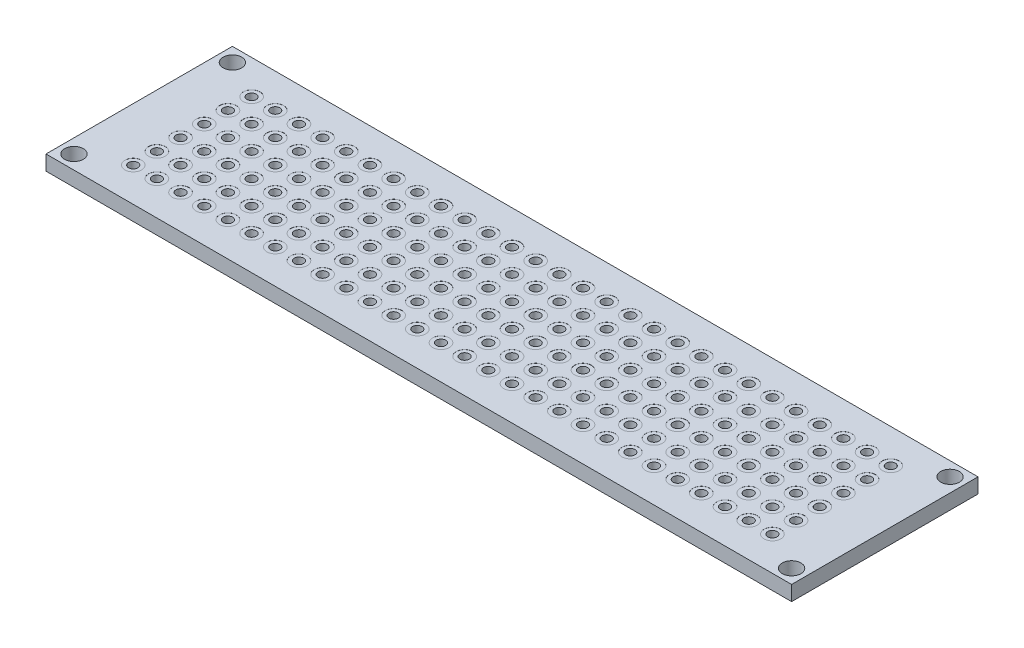
from build123d import *

# Parameters (mm, degrees)
SKETCH1_W           = 80
SKETCH1_H           = 20
SKETCH1_R           = 0.5
SKETCH1_R_2         = 1
BOSS_EXTRUDE1_DEPTH = 1.6
SKETCH2_R           = 0.9
CUT_EXTRUDE1_DEPTH  = 0.01
CUT_EXTRUDE2_START  = -0.01
SKETCH3_R           = 0.9
CUT_EXTRUDE2_DEPTH  = 0.01


with BuildPart() as part:
    # Sketch1 → Boss-Extrude1 (new body)
    with BuildSketch(Plane(origin=(0, 0, 0), x_dir=(1, 0, 0), z_dir=(0, 1, 0))):
        with Locations((40, 10)):
            Rectangle(SKETCH1_W, SKETCH1_H)
        with Locations((5.71, 16.35)):
            Circle(SKETCH1_R, mode=Mode.SUBTRACT)
        with Locations((5.71, 13.81)):
            Circle(SKETCH1_R, mode=Mode.SUBTRACT)
        with Locations((5.71, 11.27)):
            Circle(SKETCH1_R, mode=Mode.SUBTRACT)
        with Locations((5.71, 8.73)):
            Circle(SKETCH1_R, mode=Mode.SUBTRACT)
        with Locations((5.71, 6.19)):
            Circle(SKETCH1_R, mode=Mode.SUBTRACT)
        with Locations((5.71, 3.65)):
            Circle(SKETCH1_R, mode=Mode.SUBTRACT)
        with Locations((8.25, 16.35)):
            Circle(SKETCH1_R, mode=Mode.SUBTRACT)
        with Locations((8.25, 13.81)):
            Circle(SKETCH1_R, mode=Mode.SUBTRACT)
        with Locations((8.25, 11.27)):
            Circle(SKETCH1_R, mode=Mode.SUBTRACT)
        with Locations((8.25, 8.73)):
            Circle(SKETCH1_R, mode=Mode.SUBTRACT)
        with Locations((8.25, 6.19)):
            Circle(SKETCH1_R, mode=Mode.SUBTRACT)
        with Locations((8.25, 3.65)):
            Circle(SKETCH1_R, mode=Mode.SUBTRACT)
        with Locations((10.79, 16.35)):
            Circle(SKETCH1_R, mode=Mode.SUBTRACT)
        with Locations((10.79, 13.81)):
            Circle(SKETCH1_R, mode=Mode.SUBTRACT)
        with Locations((10.79, 11.27)):
            Circle(SKETCH1_R, mode=Mode.SUBTRACT)
        with Locations((10.79, 8.73)):
            Circle(SKETCH1_R, mode=Mode.SUBTRACT)
        with Locations((10.79, 6.19)):
            Circle(SKETCH1_R, mode=Mode.SUBTRACT)
        with Locations((10.79, 3.65)):
            Circle(SKETCH1_R, mode=Mode.SUBTRACT)
        with Locations((13.33, 16.35)):
            Circle(SKETCH1_R, mode=Mode.SUBTRACT)
        with Locations((13.33, 13.81)):
            Circle(SKETCH1_R, mode=Mode.SUBTRACT)
        with Locations((13.33, 11.27)):
            Circle(SKETCH1_R, mode=Mode.SUBTRACT)
        with Locations((13.33, 8.73)):
            Circle(SKETCH1_R, mode=Mode.SUBTRACT)
        with Locations((13.33, 6.19)):
            Circle(SKETCH1_R, mode=Mode.SUBTRACT)
        with Locations((13.33, 3.65)):
            Circle(SKETCH1_R, mode=Mode.SUBTRACT)
        with Locations((15.87, 16.35)):
            Circle(SKETCH1_R, mode=Mode.SUBTRACT)
        with Locations((15.87, 13.81)):
            Circle(SKETCH1_R, mode=Mode.SUBTRACT)
        with Locations((15.87, 11.27)):
            Circle(SKETCH1_R, mode=Mode.SUBTRACT)
        with Locations((15.87, 8.73)):
            Circle(SKETCH1_R, mode=Mode.SUBTRACT)
        with Locations((15.87, 6.19)):
            Circle(SKETCH1_R, mode=Mode.SUBTRACT)
        with Locations((15.87, 3.65)):
            Circle(SKETCH1_R, mode=Mode.SUBTRACT)
        with Locations((18.41, 16.35)):
            Circle(SKETCH1_R, mode=Mode.SUBTRACT)
        with Locations((18.41, 13.81)):
            Circle(SKETCH1_R, mode=Mode.SUBTRACT)
        with Locations((18.41, 11.27)):
            Circle(SKETCH1_R, mode=Mode.SUBTRACT)
        with Locations((18.41, 8.73)):
            Circle(SKETCH1_R, mode=Mode.SUBTRACT)
        with Locations((18.41, 6.19)):
            Circle(SKETCH1_R, mode=Mode.SUBTRACT)
        with Locations((18.41, 3.65)):
            Circle(SKETCH1_R, mode=Mode.SUBTRACT)
        with Locations((20.95, 16.35)):
            Circle(SKETCH1_R, mode=Mode.SUBTRACT)
        with Locations((20.95, 13.81)):
            Circle(SKETCH1_R, mode=Mode.SUBTRACT)
        with Locations((20.95, 11.27)):
            Circle(SKETCH1_R, mode=Mode.SUBTRACT)
        with Locations((20.95, 8.73)):
            Circle(SKETCH1_R, mode=Mode.SUBTRACT)
        with Locations((20.95, 6.19)):
            Circle(SKETCH1_R, mode=Mode.SUBTRACT)
        with Locations((20.95, 3.65)):
            Circle(SKETCH1_R, mode=Mode.SUBTRACT)
        with Locations((23.49, 16.35)):
            Circle(SKETCH1_R, mode=Mode.SUBTRACT)
        with Locations((23.49, 13.81)):
            Circle(SKETCH1_R, mode=Mode.SUBTRACT)
        with Locations((23.49, 11.27)):
            Circle(SKETCH1_R, mode=Mode.SUBTRACT)
        with Locations((23.49, 8.73)):
            Circle(SKETCH1_R, mode=Mode.SUBTRACT)
        with Locations((23.49, 6.19)):
            Circle(SKETCH1_R, mode=Mode.SUBTRACT)
        with Locations((23.49, 3.65)):
            Circle(SKETCH1_R, mode=Mode.SUBTRACT)
        with Locations((26.03, 16.35)):
            Circle(SKETCH1_R, mode=Mode.SUBTRACT)
        with Locations((26.03, 13.81)):
            Circle(SKETCH1_R, mode=Mode.SUBTRACT)
        with Locations((26.03, 11.27)):
            Circle(SKETCH1_R, mode=Mode.SUBTRACT)
        with Locations((26.03, 8.73)):
            Circle(SKETCH1_R, mode=Mode.SUBTRACT)
        with Locations((26.03, 6.19)):
            Circle(SKETCH1_R, mode=Mode.SUBTRACT)
        with Locations((26.03, 3.65)):
            Circle(SKETCH1_R, mode=Mode.SUBTRACT)
        with Locations((28.57, 16.35)):
            Circle(SKETCH1_R, mode=Mode.SUBTRACT)
        with Locations((28.57, 13.81)):
            Circle(SKETCH1_R, mode=Mode.SUBTRACT)
        with Locations((28.57, 11.27)):
            Circle(SKETCH1_R, mode=Mode.SUBTRACT)
        with Locations((28.57, 8.73)):
            Circle(SKETCH1_R, mode=Mode.SUBTRACT)
        with Locations((28.57, 6.19)):
            Circle(SKETCH1_R, mode=Mode.SUBTRACT)
        with Locations((28.57, 3.65)):
            Circle(SKETCH1_R, mode=Mode.SUBTRACT)
        with Locations((31.11, 16.35)):
            Circle(SKETCH1_R, mode=Mode.SUBTRACT)
        with Locations((31.11, 13.81)):
            Circle(SKETCH1_R, mode=Mode.SUBTRACT)
        with Locations((31.11, 11.27)):
            Circle(SKETCH1_R, mode=Mode.SUBTRACT)
        with Locations((31.11, 8.73)):
            Circle(SKETCH1_R, mode=Mode.SUBTRACT)
        with Locations((31.11, 6.19)):
            Circle(SKETCH1_R, mode=Mode.SUBTRACT)
        with Locations((31.11, 3.65)):
            Circle(SKETCH1_R, mode=Mode.SUBTRACT)
        with Locations((33.65, 16.35)):
            Circle(SKETCH1_R, mode=Mode.SUBTRACT)
        with Locations((33.65, 13.81)):
            Circle(SKETCH1_R, mode=Mode.SUBTRACT)
        with Locations((33.65, 11.27)):
            Circle(SKETCH1_R, mode=Mode.SUBTRACT)
        with Locations((33.65, 8.73)):
            Circle(SKETCH1_R, mode=Mode.SUBTRACT)
        with Locations((33.65, 6.19)):
            Circle(SKETCH1_R, mode=Mode.SUBTRACT)
        with Locations((33.65, 3.65)):
            Circle(SKETCH1_R, mode=Mode.SUBTRACT)
        with Locations((36.19, 16.35)):
            Circle(SKETCH1_R, mode=Mode.SUBTRACT)
        with Locations((36.19, 13.81)):
            Circle(SKETCH1_R, mode=Mode.SUBTRACT)
        with Locations((36.19, 11.27)):
            Circle(SKETCH1_R, mode=Mode.SUBTRACT)
        with Locations((36.19, 8.73)):
            Circle(SKETCH1_R, mode=Mode.SUBTRACT)
        with Locations((36.19, 6.19)):
            Circle(SKETCH1_R, mode=Mode.SUBTRACT)
        with Locations((36.19, 3.65)):
            Circle(SKETCH1_R, mode=Mode.SUBTRACT)
        with Locations((38.73, 16.35)):
            Circle(SKETCH1_R, mode=Mode.SUBTRACT)
        with Locations((38.73, 13.81)):
            Circle(SKETCH1_R, mode=Mode.SUBTRACT)
        with Locations((38.73, 11.27)):
            Circle(SKETCH1_R, mode=Mode.SUBTRACT)
        with Locations((38.73, 8.73)):
            Circle(SKETCH1_R, mode=Mode.SUBTRACT)
        with Locations((38.73, 6.19)):
            Circle(SKETCH1_R, mode=Mode.SUBTRACT)
        with Locations((38.73, 3.65)):
            Circle(SKETCH1_R, mode=Mode.SUBTRACT)
        with Locations((41.27, 16.35)):
            Circle(SKETCH1_R, mode=Mode.SUBTRACT)
        with Locations((41.27, 13.81)):
            Circle(SKETCH1_R, mode=Mode.SUBTRACT)
        with Locations((41.27, 11.27)):
            Circle(SKETCH1_R, mode=Mode.SUBTRACT)
        with Locations((41.27, 8.73)):
            Circle(SKETCH1_R, mode=Mode.SUBTRACT)
        with Locations((41.27, 6.19)):
            Circle(SKETCH1_R, mode=Mode.SUBTRACT)
        with Locations((41.27, 3.65)):
            Circle(SKETCH1_R, mode=Mode.SUBTRACT)
        with Locations((43.81, 16.35)):
            Circle(SKETCH1_R, mode=Mode.SUBTRACT)
        with Locations((43.81, 13.81)):
            Circle(SKETCH1_R, mode=Mode.SUBTRACT)
        with Locations((43.81, 11.27)):
            Circle(SKETCH1_R, mode=Mode.SUBTRACT)
        with Locations((43.81, 8.73)):
            Circle(SKETCH1_R, mode=Mode.SUBTRACT)
        with Locations((43.81, 6.19)):
            Circle(SKETCH1_R, mode=Mode.SUBTRACT)
        with Locations((43.81, 3.65)):
            Circle(SKETCH1_R, mode=Mode.SUBTRACT)
        with Locations((46.35, 16.35)):
            Circle(SKETCH1_R, mode=Mode.SUBTRACT)
        with Locations((46.35, 13.81)):
            Circle(SKETCH1_R, mode=Mode.SUBTRACT)
        with Locations((46.35, 11.27)):
            Circle(SKETCH1_R, mode=Mode.SUBTRACT)
        with Locations((46.35, 8.73)):
            Circle(SKETCH1_R, mode=Mode.SUBTRACT)
        with Locations((46.35, 6.19)):
            Circle(SKETCH1_R, mode=Mode.SUBTRACT)
        with Locations((46.35, 3.65)):
            Circle(SKETCH1_R, mode=Mode.SUBTRACT)
        with Locations((48.89, 16.35)):
            Circle(SKETCH1_R, mode=Mode.SUBTRACT)
        with Locations((48.89, 13.81)):
            Circle(SKETCH1_R, mode=Mode.SUBTRACT)
        with Locations((48.89, 11.27)):
            Circle(SKETCH1_R, mode=Mode.SUBTRACT)
        with Locations((48.89, 8.73)):
            Circle(SKETCH1_R, mode=Mode.SUBTRACT)
        with Locations((48.89, 6.19)):
            Circle(SKETCH1_R, mode=Mode.SUBTRACT)
        with Locations((48.89, 3.65)):
            Circle(SKETCH1_R, mode=Mode.SUBTRACT)
        with Locations((51.43, 16.35)):
            Circle(SKETCH1_R, mode=Mode.SUBTRACT)
        with Locations((51.43, 13.81)):
            Circle(SKETCH1_R, mode=Mode.SUBTRACT)
        with Locations((51.43, 11.27)):
            Circle(SKETCH1_R, mode=Mode.SUBTRACT)
        with Locations((51.43, 8.73)):
            Circle(SKETCH1_R, mode=Mode.SUBTRACT)
        with Locations((51.43, 6.19)):
            Circle(SKETCH1_R, mode=Mode.SUBTRACT)
        with Locations((51.43, 3.65)):
            Circle(SKETCH1_R, mode=Mode.SUBTRACT)
        with Locations((53.97, 16.35)):
            Circle(SKETCH1_R, mode=Mode.SUBTRACT)
        with Locations((53.97, 13.81)):
            Circle(SKETCH1_R, mode=Mode.SUBTRACT)
        with Locations((53.97, 11.27)):
            Circle(SKETCH1_R, mode=Mode.SUBTRACT)
        with Locations((53.97, 8.73)):
            Circle(SKETCH1_R, mode=Mode.SUBTRACT)
        with Locations((53.97, 6.19)):
            Circle(SKETCH1_R, mode=Mode.SUBTRACT)
        with Locations((53.97, 3.65)):
            Circle(SKETCH1_R, mode=Mode.SUBTRACT)
        with Locations((56.51, 16.35)):
            Circle(SKETCH1_R, mode=Mode.SUBTRACT)
        with Locations((56.51, 13.81)):
            Circle(SKETCH1_R, mode=Mode.SUBTRACT)
        with Locations((56.51, 11.27)):
            Circle(SKETCH1_R, mode=Mode.SUBTRACT)
        with Locations((56.51, 8.73)):
            Circle(SKETCH1_R, mode=Mode.SUBTRACT)
        with Locations((56.51, 6.19)):
            Circle(SKETCH1_R, mode=Mode.SUBTRACT)
        with Locations((56.51, 3.65)):
            Circle(SKETCH1_R, mode=Mode.SUBTRACT)
        with Locations((59.05, 16.35)):
            Circle(SKETCH1_R, mode=Mode.SUBTRACT)
        with Locations((59.05, 13.81)):
            Circle(SKETCH1_R, mode=Mode.SUBTRACT)
        with Locations((59.05, 11.27)):
            Circle(SKETCH1_R, mode=Mode.SUBTRACT)
        with Locations((59.05, 8.73)):
            Circle(SKETCH1_R, mode=Mode.SUBTRACT)
        with Locations((59.05, 6.19)):
            Circle(SKETCH1_R, mode=Mode.SUBTRACT)
        with Locations((59.05, 3.65)):
            Circle(SKETCH1_R, mode=Mode.SUBTRACT)
        with Locations((61.59, 16.35)):
            Circle(SKETCH1_R, mode=Mode.SUBTRACT)
        with Locations((61.59, 13.81)):
            Circle(SKETCH1_R, mode=Mode.SUBTRACT)
        with Locations((61.59, 11.27)):
            Circle(SKETCH1_R, mode=Mode.SUBTRACT)
        with Locations((61.59, 8.73)):
            Circle(SKETCH1_R, mode=Mode.SUBTRACT)
        with Locations((61.59, 6.19)):
            Circle(SKETCH1_R, mode=Mode.SUBTRACT)
        with Locations((61.59, 3.65)):
            Circle(SKETCH1_R, mode=Mode.SUBTRACT)
        with Locations((64.13, 16.35)):
            Circle(SKETCH1_R, mode=Mode.SUBTRACT)
        with Locations((64.13, 13.81)):
            Circle(SKETCH1_R, mode=Mode.SUBTRACT)
        with Locations((64.13, 11.27)):
            Circle(SKETCH1_R, mode=Mode.SUBTRACT)
        with Locations((64.13, 8.73)):
            Circle(SKETCH1_R, mode=Mode.SUBTRACT)
        with Locations((64.13, 6.19)):
            Circle(SKETCH1_R, mode=Mode.SUBTRACT)
        with Locations((64.13, 3.65)):
            Circle(SKETCH1_R, mode=Mode.SUBTRACT)
        with Locations((66.67, 16.35)):
            Circle(SKETCH1_R, mode=Mode.SUBTRACT)
        with Locations((66.67, 13.81)):
            Circle(SKETCH1_R, mode=Mode.SUBTRACT)
        with Locations((66.67, 11.27)):
            Circle(SKETCH1_R, mode=Mode.SUBTRACT)
        with Locations((66.67, 8.73)):
            Circle(SKETCH1_R, mode=Mode.SUBTRACT)
        with Locations((66.67, 6.19)):
            Circle(SKETCH1_R, mode=Mode.SUBTRACT)
        with Locations((66.67, 3.65)):
            Circle(SKETCH1_R, mode=Mode.SUBTRACT)
        with Locations((69.21, 16.35)):
            Circle(SKETCH1_R, mode=Mode.SUBTRACT)
        with Locations((69.21, 13.81)):
            Circle(SKETCH1_R, mode=Mode.SUBTRACT)
        with Locations((69.21, 11.27)):
            Circle(SKETCH1_R, mode=Mode.SUBTRACT)
        with Locations((69.21, 8.73)):
            Circle(SKETCH1_R, mode=Mode.SUBTRACT)
        with Locations((69.21, 6.19)):
            Circle(SKETCH1_R, mode=Mode.SUBTRACT)
        with Locations((69.21, 3.65)):
            Circle(SKETCH1_R, mode=Mode.SUBTRACT)
        with Locations((71.75, 16.35)):
            Circle(SKETCH1_R, mode=Mode.SUBTRACT)
        with Locations((71.75, 13.81)):
            Circle(SKETCH1_R, mode=Mode.SUBTRACT)
        with Locations((71.75, 11.27)):
            Circle(SKETCH1_R, mode=Mode.SUBTRACT)
        with Locations((71.75, 8.73)):
            Circle(SKETCH1_R, mode=Mode.SUBTRACT)
        with Locations((71.75, 6.19)):
            Circle(SKETCH1_R, mode=Mode.SUBTRACT)
        with Locations((71.75, 3.65)):
            Circle(SKETCH1_R, mode=Mode.SUBTRACT)
        with Locations((74.29, 16.35)):
            Circle(SKETCH1_R, mode=Mode.SUBTRACT)
        with Locations((74.29, 13.81)):
            Circle(SKETCH1_R, mode=Mode.SUBTRACT)
        with Locations((74.29, 11.27)):
            Circle(SKETCH1_R, mode=Mode.SUBTRACT)
        with Locations((74.29, 8.73)):
            Circle(SKETCH1_R, mode=Mode.SUBTRACT)
        with Locations((74.29, 6.19)):
            Circle(SKETCH1_R, mode=Mode.SUBTRACT)
        with Locations((74.29, 3.65)):
            Circle(SKETCH1_R, mode=Mode.SUBTRACT)
        with Locations((1.5, 18.5)):
            Circle(SKETCH1_R_2, mode=Mode.SUBTRACT)
        with Locations((78.5, 18.5)):
            Circle(SKETCH1_R_2, mode=Mode.SUBTRACT)
        with Locations((1.5, 1.5)):
            Circle(SKETCH1_R_2, mode=Mode.SUBTRACT)
        with Locations((78.5, 1.5)):
            Circle(SKETCH1_R_2, mode=Mode.SUBTRACT)
    extrude(amount=BOSS_EXTRUDE1_DEPTH)

    # Sketch2 → Cut-Extrude1 (cut)
    with BuildSketch(Plane(origin=(0, 1.6, 0), x_dir=(1, 0, 0), z_dir=(0, 1, 0))):
        with Locations((5.71, 16.35)):
            Circle(SKETCH2_R)
        with Locations((8.25, 16.35)):
            Circle(SKETCH2_R)
        with Locations((10.79, 16.35)):
            Circle(SKETCH2_R)
        with Locations((13.33, 16.35)):
            Circle(SKETCH2_R)
        with Locations((15.87, 16.35)):
            Circle(SKETCH2_R)
        with Locations((18.41, 16.35)):
            Circle(SKETCH2_R)
        with Locations((20.95, 16.35)):
            Circle(SKETCH2_R)
        with Locations((23.49, 16.35)):
            Circle(SKETCH2_R)
        with Locations((26.03, 16.35)):
            Circle(SKETCH2_R)
        with Locations((28.57, 16.35)):
            Circle(SKETCH2_R)
        with Locations((31.11, 16.35)):
            Circle(SKETCH2_R)
        with Locations((33.65, 16.35)):
            Circle(SKETCH2_R)
        with Locations((36.19, 16.35)):
            Circle(SKETCH2_R)
        with Locations((38.73, 16.35)):
            Circle(SKETCH2_R)
        with Locations((41.27, 16.35)):
            Circle(SKETCH2_R)
        with Locations((43.81, 16.35)):
            Circle(SKETCH2_R)
        with Locations((46.35, 16.35)):
            Circle(SKETCH2_R)
        with Locations((48.89, 16.35)):
            Circle(SKETCH2_R)
        with Locations((51.43, 16.35)):
            Circle(SKETCH2_R)
        with Locations((53.97, 16.35)):
            Circle(SKETCH2_R)
        with Locations((56.51, 16.35)):
            Circle(SKETCH2_R)
        with Locations((59.05, 16.35)):
            Circle(SKETCH2_R)
        with Locations((61.59, 16.35)):
            Circle(SKETCH2_R)
        with Locations((64.13, 16.35)):
            Circle(SKETCH2_R)
        with Locations((66.67, 16.35)):
            Circle(SKETCH2_R)
        with Locations((69.21, 16.35)):
            Circle(SKETCH2_R)
        with Locations((71.75, 16.35)):
            Circle(SKETCH2_R)
        with Locations((74.29, 16.35)):
            Circle(SKETCH2_R)
        with Locations((8.25, 13.81)):
            Circle(SKETCH2_R)
        with Locations((10.79, 13.81)):
            Circle(SKETCH2_R)
        with Locations((13.33, 13.81)):
            Circle(SKETCH2_R)
        with Locations((15.87, 13.81)):
            Circle(SKETCH2_R)
        with Locations((18.41, 13.81)):
            Circle(SKETCH2_R)
        with Locations((20.95, 13.81)):
            Circle(SKETCH2_R)
        with Locations((23.49, 13.81)):
            Circle(SKETCH2_R)
        with Locations((26.03, 13.81)):
            Circle(SKETCH2_R)
        with Locations((28.57, 13.81)):
            Circle(SKETCH2_R)
        with Locations((31.11, 13.81)):
            Circle(SKETCH2_R)
        with Locations((33.65, 13.81)):
            Circle(SKETCH2_R)
        with Locations((36.19, 13.81)):
            Circle(SKETCH2_R)
        with Locations((38.73, 13.81)):
            Circle(SKETCH2_R)
        with Locations((41.27, 13.81)):
            Circle(SKETCH2_R)
        with Locations((43.81, 13.81)):
            Circle(SKETCH2_R)
        with Locations((46.35, 13.81)):
            Circle(SKETCH2_R)
        with Locations((48.89, 13.81)):
            Circle(SKETCH2_R)
        with Locations((51.43, 13.81)):
            Circle(SKETCH2_R)
        with Locations((53.97, 13.81)):
            Circle(SKETCH2_R)
        with Locations((56.51, 13.81)):
            Circle(SKETCH2_R)
        with Locations((59.05, 13.81)):
            Circle(SKETCH2_R)
        with Locations((61.59, 13.81)):
            Circle(SKETCH2_R)
        with Locations((64.13, 13.81)):
            Circle(SKETCH2_R)
        with Locations((66.67, 13.81)):
            Circle(SKETCH2_R)
        with Locations((69.21, 13.81)):
            Circle(SKETCH2_R)
        with Locations((71.75, 13.81)):
            Circle(SKETCH2_R)
        with Locations((74.29, 13.81)):
            Circle(SKETCH2_R)
        with Locations((8.25, 11.27)):
            Circle(SKETCH2_R)
        with Locations((10.79, 11.27)):
            Circle(SKETCH2_R)
        with Locations((13.33, 11.27)):
            Circle(SKETCH2_R)
        with Locations((15.87, 11.27)):
            Circle(SKETCH2_R)
        with Locations((18.41, 11.27)):
            Circle(SKETCH2_R)
        with Locations((20.95, 11.27)):
            Circle(SKETCH2_R)
        with Locations((23.49, 11.27)):
            Circle(SKETCH2_R)
        with Locations((26.03, 11.27)):
            Circle(SKETCH2_R)
        with Locations((28.57, 11.27)):
            Circle(SKETCH2_R)
        with Locations((31.11, 11.27)):
            Circle(SKETCH2_R)
        with Locations((33.65, 11.27)):
            Circle(SKETCH2_R)
        with Locations((36.19, 11.27)):
            Circle(SKETCH2_R)
        with Locations((38.73, 11.27)):
            Circle(SKETCH2_R)
        with Locations((41.27, 11.27)):
            Circle(SKETCH2_R)
        with Locations((43.81, 11.27)):
            Circle(SKETCH2_R)
        with Locations((46.35, 11.27)):
            Circle(SKETCH2_R)
        with Locations((48.89, 11.27)):
            Circle(SKETCH2_R)
        with Locations((51.43, 11.27)):
            Circle(SKETCH2_R)
        with Locations((53.97, 11.27)):
            Circle(SKETCH2_R)
        with Locations((56.51, 11.27)):
            Circle(SKETCH2_R)
        with Locations((59.05, 11.27)):
            Circle(SKETCH2_R)
        with Locations((61.59, 11.27)):
            Circle(SKETCH2_R)
        with Locations((64.13, 11.27)):
            Circle(SKETCH2_R)
        with Locations((66.67, 11.27)):
            Circle(SKETCH2_R)
        with Locations((69.21, 11.27)):
            Circle(SKETCH2_R)
        with Locations((71.75, 11.27)):
            Circle(SKETCH2_R)
        with Locations((74.29, 11.27)):
            Circle(SKETCH2_R)
        with Locations((8.25, 8.73)):
            Circle(SKETCH2_R)
        with Locations((10.79, 8.73)):
            Circle(SKETCH2_R)
        with Locations((13.33, 8.73)):
            Circle(SKETCH2_R)
        with Locations((15.87, 8.73)):
            Circle(SKETCH2_R)
        with Locations((18.41, 8.73)):
            Circle(SKETCH2_R)
        with Locations((20.95, 8.73)):
            Circle(SKETCH2_R)
        with Locations((23.49, 8.73)):
            Circle(SKETCH2_R)
        with Locations((26.03, 8.73)):
            Circle(SKETCH2_R)
        with Locations((28.57, 8.73)):
            Circle(SKETCH2_R)
        with Locations((31.11, 8.73)):
            Circle(SKETCH2_R)
        with Locations((33.65, 8.73)):
            Circle(SKETCH2_R)
        with Locations((36.19, 8.73)):
            Circle(SKETCH2_R)
        with Locations((38.73, 8.73)):
            Circle(SKETCH2_R)
        with Locations((41.27, 8.73)):
            Circle(SKETCH2_R)
        with Locations((43.81, 8.73)):
            Circle(SKETCH2_R)
        with Locations((46.35, 8.73)):
            Circle(SKETCH2_R)
        with Locations((48.89, 8.73)):
            Circle(SKETCH2_R)
        with Locations((51.43, 8.73)):
            Circle(SKETCH2_R)
        with Locations((53.97, 8.73)):
            Circle(SKETCH2_R)
        with Locations((56.51, 8.73)):
            Circle(SKETCH2_R)
        with Locations((59.05, 8.73)):
            Circle(SKETCH2_R)
        with Locations((61.59, 8.73)):
            Circle(SKETCH2_R)
        with Locations((64.13, 8.73)):
            Circle(SKETCH2_R)
        with Locations((66.67, 8.73)):
            Circle(SKETCH2_R)
        with Locations((69.21, 8.73)):
            Circle(SKETCH2_R)
        with Locations((71.75, 8.73)):
            Circle(SKETCH2_R)
        with Locations((74.29, 8.73)):
            Circle(SKETCH2_R)
        with Locations((8.25, 6.19)):
            Circle(SKETCH2_R)
        with Locations((10.79, 6.19)):
            Circle(SKETCH2_R)
        with Locations((13.33, 6.19)):
            Circle(SKETCH2_R)
        with Locations((15.87, 6.19)):
            Circle(SKETCH2_R)
        with Locations((18.41, 6.19)):
            Circle(SKETCH2_R)
        with Locations((20.95, 6.19)):
            Circle(SKETCH2_R)
        with Locations((23.49, 6.19)):
            Circle(SKETCH2_R)
        with Locations((26.03, 6.19)):
            Circle(SKETCH2_R)
        with Locations((28.57, 6.19)):
            Circle(SKETCH2_R)
        with Locations((31.11, 6.19)):
            Circle(SKETCH2_R)
        with Locations((33.65, 6.19)):
            Circle(SKETCH2_R)
        with Locations((36.19, 6.19)):
            Circle(SKETCH2_R)
        with Locations((38.73, 6.19)):
            Circle(SKETCH2_R)
        with Locations((41.27, 6.19)):
            Circle(SKETCH2_R)
        with Locations((43.81, 6.19)):
            Circle(SKETCH2_R)
        with Locations((46.35, 6.19)):
            Circle(SKETCH2_R)
        with Locations((48.89, 6.19)):
            Circle(SKETCH2_R)
        with Locations((51.43, 6.19)):
            Circle(SKETCH2_R)
        with Locations((53.97, 6.19)):
            Circle(SKETCH2_R)
        with Locations((56.51, 6.19)):
            Circle(SKETCH2_R)
        with Locations((59.05, 6.19)):
            Circle(SKETCH2_R)
        with Locations((61.59, 6.19)):
            Circle(SKETCH2_R)
        with Locations((64.13, 6.19)):
            Circle(SKETCH2_R)
        with Locations((66.67, 6.19)):
            Circle(SKETCH2_R)
        with Locations((69.21, 6.19)):
            Circle(SKETCH2_R)
        with Locations((71.75, 6.19)):
            Circle(SKETCH2_R)
        with Locations((74.29, 6.19)):
            Circle(SKETCH2_R)
        with Locations((8.25, 3.65)):
            Circle(SKETCH2_R)
        with Locations((10.79, 3.65)):
            Circle(SKETCH2_R)
        with Locations((13.33, 3.65)):
            Circle(SKETCH2_R)
        with Locations((15.87, 3.65)):
            Circle(SKETCH2_R)
        with Locations((18.41, 3.65)):
            Circle(SKETCH2_R)
        with Locations((20.95, 3.65)):
            Circle(SKETCH2_R)
        with Locations((23.49, 3.65)):
            Circle(SKETCH2_R)
        with Locations((26.03, 3.65)):
            Circle(SKETCH2_R)
        with Locations((28.57, 3.65)):
            Circle(SKETCH2_R)
        with Locations((31.11, 3.65)):
            Circle(SKETCH2_R)
        with Locations((33.65, 3.65)):
            Circle(SKETCH2_R)
        with Locations((36.19, 3.65)):
            Circle(SKETCH2_R)
        with Locations((38.73, 3.65)):
            Circle(SKETCH2_R)
        with Locations((41.27, 3.65)):
            Circle(SKETCH2_R)
        with Locations((43.81, 3.65)):
            Circle(SKETCH2_R)
        with Locations((46.35, 3.65)):
            Circle(SKETCH2_R)
        with Locations((48.89, 3.65)):
            Circle(SKETCH2_R)
        with Locations((51.43, 3.65)):
            Circle(SKETCH2_R)
        with Locations((53.97, 3.65)):
            Circle(SKETCH2_R)
        with Locations((56.51, 3.65)):
            Circle(SKETCH2_R)
        with Locations((59.05, 3.65)):
            Circle(SKETCH2_R)
        with Locations((61.59, 3.65)):
            Circle(SKETCH2_R)
        with Locations((64.13, 3.65)):
            Circle(SKETCH2_R)
        with Locations((66.67, 3.65)):
            Circle(SKETCH2_R)
        with Locations((69.21, 3.65)):
            Circle(SKETCH2_R)
        with Locations((71.75, 3.65)):
            Circle(SKETCH2_R)
        with Locations((74.29, 3.65)):
            Circle(SKETCH2_R)
        with Locations((5.71, 13.81)):
            Circle(SKETCH2_R)
        with Locations((5.71, 11.27)):
            Circle(SKETCH2_R)
        with Locations((5.71, 8.73)):
            Circle(SKETCH2_R)
        with Locations((5.71, 6.19)):
            Circle(SKETCH2_R)
        with Locations((5.71, 3.65)):
            Circle(SKETCH2_R)
    extrude(amount=-CUT_EXTRUDE1_DEPTH, mode=Mode.SUBTRACT)

    # Sketch3 → Cut-Extrude2 (cut)
    with BuildSketch(Plane.XZ.offset(CUT_EXTRUDE2_START)):
        with Locations((20.95, -3.65)):
            Circle(SKETCH3_R)
        with Locations((18.41, -3.65)):
            Circle(SKETCH3_R)
        with Locations((15.87, -3.65)):
            Circle(SKETCH3_R)
        with Locations((13.33, -3.65)):
            Circle(SKETCH3_R)
        with Locations((10.79, -3.65)):
            Circle(SKETCH3_R)
        with Locations((8.25, -3.65)):
            Circle(SKETCH3_R)
        with Locations((74.29, -6.19)):
            Circle(SKETCH3_R)
        with Locations((71.75, -6.19)):
            Circle(SKETCH3_R)
        with Locations((18.41, -16.35)):
            Circle(SKETCH3_R)
        with Locations((15.87, -16.35)):
            Circle(SKETCH3_R)
        with Locations((13.33, -16.35)):
            Circle(SKETCH3_R)
        with Locations((10.79, -16.35)):
            Circle(SKETCH3_R)
        with Locations((8.25, -16.35)):
            Circle(SKETCH3_R)
        with Locations((5.71, -16.35)):
            Circle(SKETCH3_R)
        with Locations((41.27, -3.65)):
            Circle(SKETCH3_R)
        with Locations((38.73, -3.65)):
            Circle(SKETCH3_R)
        with Locations((36.19, -3.65)):
            Circle(SKETCH3_R)
        with Locations((33.65, -3.65)):
            Circle(SKETCH3_R)
        with Locations((31.11, -3.65)):
            Circle(SKETCH3_R)
        with Locations((28.57, -3.65)):
            Circle(SKETCH3_R)
        with Locations((26.03, -3.65)):
            Circle(SKETCH3_R)
        with Locations((23.49, -3.65)):
            Circle(SKETCH3_R)
        with Locations((38.73, -16.35)):
            Circle(SKETCH3_R)
        with Locations((36.19, -16.35)):
            Circle(SKETCH3_R)
        with Locations((33.65, -16.35)):
            Circle(SKETCH3_R)
        with Locations((31.11, -16.35)):
            Circle(SKETCH3_R)
        with Locations((28.57, -16.35)):
            Circle(SKETCH3_R)
        with Locations((26.03, -16.35)):
            Circle(SKETCH3_R)
        with Locations((23.49, -16.35)):
            Circle(SKETCH3_R)
        with Locations((20.95, -16.35)):
            Circle(SKETCH3_R)
        with Locations((61.59, -3.65)):
            Circle(SKETCH3_R)
        with Locations((59.05, -3.65)):
            Circle(SKETCH3_R)
        with Locations((56.51, -3.65)):
            Circle(SKETCH3_R)
        with Locations((53.97, -3.65)):
            Circle(SKETCH3_R)
        with Locations((51.43, -3.65)):
            Circle(SKETCH3_R)
        with Locations((48.89, -3.65)):
            Circle(SKETCH3_R)
        with Locations((46.35, -3.65)):
            Circle(SKETCH3_R)
        with Locations((43.81, -3.65)):
            Circle(SKETCH3_R)
        with Locations((59.05, -16.35)):
            Circle(SKETCH3_R)
        with Locations((56.51, -16.35)):
            Circle(SKETCH3_R)
        with Locations((53.97, -16.35)):
            Circle(SKETCH3_R)
        with Locations((51.43, -16.35)):
            Circle(SKETCH3_R)
        with Locations((48.89, -16.35)):
            Circle(SKETCH3_R)
        with Locations((46.35, -16.35)):
            Circle(SKETCH3_R)
        with Locations((43.81, -16.35)):
            Circle(SKETCH3_R)
        with Locations((41.27, -16.35)):
            Circle(SKETCH3_R)
        with Locations((5.71, -8.73)):
            Circle(SKETCH3_R)
        with Locations((5.71, -11.27)):
            Circle(SKETCH3_R)
        with Locations((5.71, -13.81)):
            Circle(SKETCH3_R)
        with Locations((74.29, -3.65)):
            Circle(SKETCH3_R)
        with Locations((71.75, -3.65)):
            Circle(SKETCH3_R)
        with Locations((69.21, -3.65)):
            Circle(SKETCH3_R)
        with Locations((66.67, -3.65)):
            Circle(SKETCH3_R)
        with Locations((64.13, -3.65)):
            Circle(SKETCH3_R)
        with Locations((10.79, -13.81)):
            Circle(SKETCH3_R)
        with Locations((8.25, -13.81)):
            Circle(SKETCH3_R)
        with Locations((74.29, -16.35)):
            Circle(SKETCH3_R)
        with Locations((71.75, -16.35)):
            Circle(SKETCH3_R)
        with Locations((69.21, -16.35)):
            Circle(SKETCH3_R)
        with Locations((66.67, -16.35)):
            Circle(SKETCH3_R)
        with Locations((64.13, -16.35)):
            Circle(SKETCH3_R)
        with Locations((61.59, -16.35)):
            Circle(SKETCH3_R)
        with Locations((5.71, -3.65)):
            Circle(SKETCH3_R)
        with Locations((5.71, -6.19)):
            Circle(SKETCH3_R)
        with Locations((31.11, -13.81)):
            Circle(SKETCH3_R)
        with Locations((28.57, -13.81)):
            Circle(SKETCH3_R)
        with Locations((26.03, -13.81)):
            Circle(SKETCH3_R)
        with Locations((23.49, -13.81)):
            Circle(SKETCH3_R)
        with Locations((20.95, -13.81)):
            Circle(SKETCH3_R)
        with Locations((18.41, -13.81)):
            Circle(SKETCH3_R)
        with Locations((15.87, -13.81)):
            Circle(SKETCH3_R)
        with Locations((13.33, -13.81)):
            Circle(SKETCH3_R)
        with Locations((51.43, -13.81)):
            Circle(SKETCH3_R)
        with Locations((48.89, -13.81)):
            Circle(SKETCH3_R)
        with Locations((46.35, -13.81)):
            Circle(SKETCH3_R)
        with Locations((43.81, -13.81)):
            Circle(SKETCH3_R)
        with Locations((41.27, -13.81)):
            Circle(SKETCH3_R)
        with Locations((38.73, -13.81)):
            Circle(SKETCH3_R)
        with Locations((36.19, -13.81)):
            Circle(SKETCH3_R)
        with Locations((33.65, -13.81)):
            Circle(SKETCH3_R)
        with Locations((71.75, -13.81)):
            Circle(SKETCH3_R)
        with Locations((69.21, -13.81)):
            Circle(SKETCH3_R)
        with Locations((66.67, -13.81)):
            Circle(SKETCH3_R)
        with Locations((64.13, -13.81)):
            Circle(SKETCH3_R)
        with Locations((61.59, -13.81)):
            Circle(SKETCH3_R)
        with Locations((59.05, -13.81)):
            Circle(SKETCH3_R)
        with Locations((56.51, -13.81)):
            Circle(SKETCH3_R)
        with Locations((53.97, -13.81)):
            Circle(SKETCH3_R)
        with Locations((23.49, -11.27)):
            Circle(SKETCH3_R)
        with Locations((20.95, -11.27)):
            Circle(SKETCH3_R)
        with Locations((18.41, -11.27)):
            Circle(SKETCH3_R)
        with Locations((15.87, -11.27)):
            Circle(SKETCH3_R)
        with Locations((13.33, -11.27)):
            Circle(SKETCH3_R)
        with Locations((10.79, -11.27)):
            Circle(SKETCH3_R)
        with Locations((8.25, -11.27)):
            Circle(SKETCH3_R)
        with Locations((74.29, -13.81)):
            Circle(SKETCH3_R)
        with Locations((43.81, -11.27)):
            Circle(SKETCH3_R)
        with Locations((41.27, -11.27)):
            Circle(SKETCH3_R)
        with Locations((38.73, -11.27)):
            Circle(SKETCH3_R)
        with Locations((36.19, -11.27)):
            Circle(SKETCH3_R)
        with Locations((33.65, -11.27)):
            Circle(SKETCH3_R)
        with Locations((31.11, -11.27)):
            Circle(SKETCH3_R)
        with Locations((28.57, -11.27)):
            Circle(SKETCH3_R)
        with Locations((26.03, -11.27)):
            Circle(SKETCH3_R)
        with Locations((64.13, -11.27)):
            Circle(SKETCH3_R)
        with Locations((61.59, -11.27)):
            Circle(SKETCH3_R)
        with Locations((59.05, -11.27)):
            Circle(SKETCH3_R)
        with Locations((56.51, -11.27)):
            Circle(SKETCH3_R)
        with Locations((53.97, -11.27)):
            Circle(SKETCH3_R)
        with Locations((51.43, -11.27)):
            Circle(SKETCH3_R)
        with Locations((48.89, -11.27)):
            Circle(SKETCH3_R)
        with Locations((46.35, -11.27)):
            Circle(SKETCH3_R)
        with Locations((15.87, -8.73)):
            Circle(SKETCH3_R)
        with Locations((13.33, -8.73)):
            Circle(SKETCH3_R)
        with Locations((10.79, -8.73)):
            Circle(SKETCH3_R)
        with Locations((8.25, -8.73)):
            Circle(SKETCH3_R)
        with Locations((74.29, -11.27)):
            Circle(SKETCH3_R)
        with Locations((71.75, -11.27)):
            Circle(SKETCH3_R)
        with Locations((69.21, -11.27)):
            Circle(SKETCH3_R)
        with Locations((66.67, -11.27)):
            Circle(SKETCH3_R)
        with Locations((36.19, -8.73)):
            Circle(SKETCH3_R)
        with Locations((33.65, -8.73)):
            Circle(SKETCH3_R)
        with Locations((31.11, -8.73)):
            Circle(SKETCH3_R)
        with Locations((28.57, -8.73)):
            Circle(SKETCH3_R)
        with Locations((26.03, -8.73)):
            Circle(SKETCH3_R)
        with Locations((23.49, -8.73)):
            Circle(SKETCH3_R)
        with Locations((20.95, -8.73)):
            Circle(SKETCH3_R)
        with Locations((18.41, -8.73)):
            Circle(SKETCH3_R)
        with Locations((56.51, -8.73)):
            Circle(SKETCH3_R)
        with Locations((53.97, -8.73)):
            Circle(SKETCH3_R)
        with Locations((51.43, -8.73)):
            Circle(SKETCH3_R)
        with Locations((48.89, -8.73)):
            Circle(SKETCH3_R)
        with Locations((46.35, -8.73)):
            Circle(SKETCH3_R)
        with Locations((43.81, -8.73)):
            Circle(SKETCH3_R)
        with Locations((41.27, -8.73)):
            Circle(SKETCH3_R)
        with Locations((38.73, -8.73)):
            Circle(SKETCH3_R)
        with Locations((8.25, -6.19)):
            Circle(SKETCH3_R)
        with Locations((74.29, -8.73)):
            Circle(SKETCH3_R)
        with Locations((71.75, -8.73)):
            Circle(SKETCH3_R)
        with Locations((69.21, -8.73)):
            Circle(SKETCH3_R)
        with Locations((66.67, -8.73)):
            Circle(SKETCH3_R)
        with Locations((64.13, -8.73)):
            Circle(SKETCH3_R)
        with Locations((61.59, -8.73)):
            Circle(SKETCH3_R)
        with Locations((59.05, -8.73)):
            Circle(SKETCH3_R)
        with Locations((28.57, -6.19)):
            Circle(SKETCH3_R)
        with Locations((26.03, -6.19)):
            Circle(SKETCH3_R)
        with Locations((23.49, -6.19)):
            Circle(SKETCH3_R)
        with Locations((20.95, -6.19)):
            Circle(SKETCH3_R)
        with Locations((18.41, -6.19)):
            Circle(SKETCH3_R)
        with Locations((15.87, -6.19)):
            Circle(SKETCH3_R)
        with Locations((13.33, -6.19)):
            Circle(SKETCH3_R)
        with Locations((10.79, -6.19)):
            Circle(SKETCH3_R)
        with Locations((48.89, -6.19)):
            Circle(SKETCH3_R)
        with Locations((46.35, -6.19)):
            Circle(SKETCH3_R)
        with Locations((43.81, -6.19)):
            Circle(SKETCH3_R)
        with Locations((41.27, -6.19)):
            Circle(SKETCH3_R)
        with Locations((38.73, -6.19)):
            Circle(SKETCH3_R)
        with Locations((36.19, -6.19)):
            Circle(SKETCH3_R)
        with Locations((33.65, -6.19)):
            Circle(SKETCH3_R)
        with Locations((31.11, -6.19)):
            Circle(SKETCH3_R)
        with Locations((69.21, -6.19)):
            Circle(SKETCH3_R)
        with Locations((66.67, -6.19)):
            Circle(SKETCH3_R)
        with Locations((64.13, -6.19)):
            Circle(SKETCH3_R)
        with Locations((61.59, -6.19)):
            Circle(SKETCH3_R)
        with Locations((59.05, -6.19)):
            Circle(SKETCH3_R)
        with Locations((56.51, -6.19)):
            Circle(SKETCH3_R)
        with Locations((53.97, -6.19)):
            Circle(SKETCH3_R)
        with Locations((51.43, -6.19)):
            Circle(SKETCH3_R)
    extrude(amount=CUT_EXTRUDE2_DEPTH, mode=Mode.SUBTRACT)


solid = part.part
